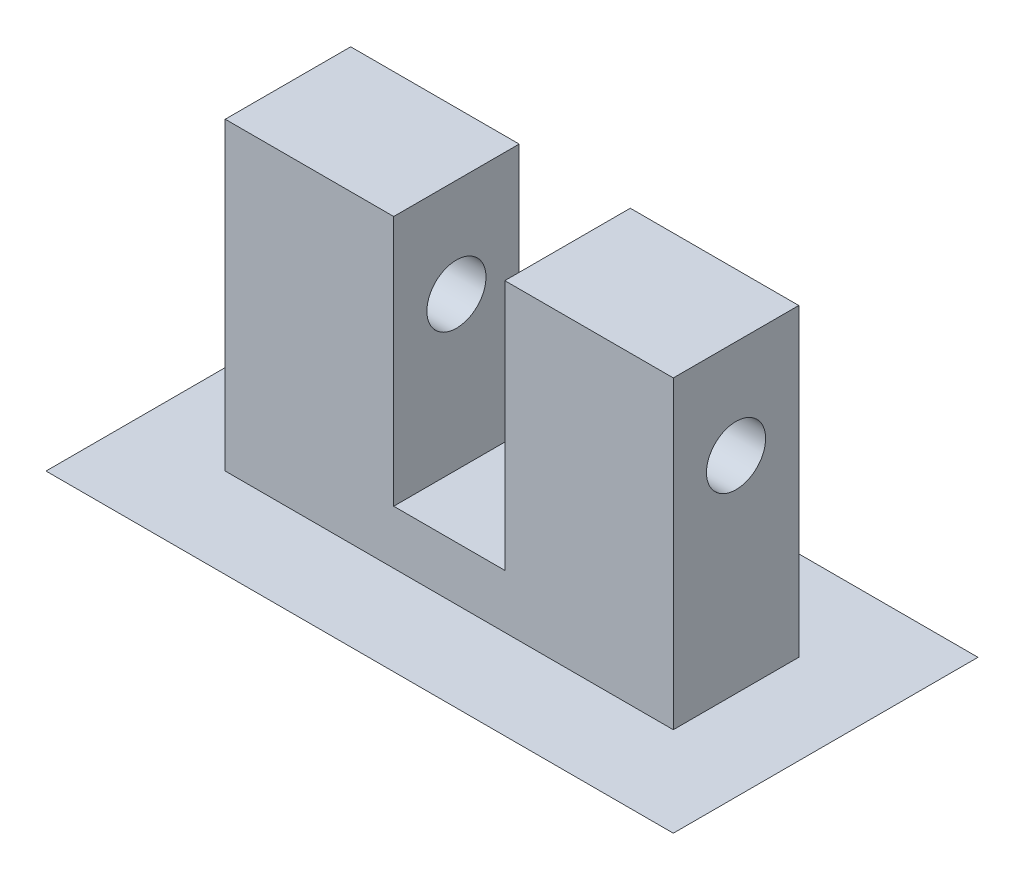
from build123d import *

# Parameters (mm, degrees)
SKETCH1_W           = 25
SKETCH1_H           = 7
BOSS_EXTRUDE1_DEPTH = 20
SKETCH2_W           = 35
SKETCH2_H           = 17
BOSS_EXTRUDE2_DEPTH = 3
CHAMFER1_SIZE       = 5.196152423
CHAMFER1_SIZE_2     = 3
SKETCH3_W           = 6.2
SKETCH3_H           = 14
CUT_EXTRUDE1_DEPTH  = 7
CUT_EXTRUDE2_REACH  = 40
SKETCH4_R           = 1.65


with BuildPart() as part:
    # Sketch1 → Boss-Extrude1 (new body)
    with BuildSketch(Plane(origin=(0, 0, 0), x_dir=(1, 0, 0), z_dir=(0, 1, 0))):
        with Locations((12.5, 3.5)):
            Rectangle(SKETCH1_W, SKETCH1_H)
    extrude(amount=BOSS_EXTRUDE1_DEPTH)

    # Sketch2 → Boss-Extrude2 (add)
    with BuildSketch(Plane.XZ):
        with Locations((12.5, -3.5)):
            Rectangle(SKETCH2_W, SKETCH2_H)
    extrude(amount=-BOSS_EXTRUDE2_DEPTH)

    # Chamfer1
    # the kernel refuses this chamfer: 5.196152423, 3 mm, written as the material it takes off along each edge
    with BuildSketch(Plane(origin=(30, 0, 18.442891912), x_dir=(-0.9998132206222079, -0.01932676561270063, 0), z_dir=(0, 0, -1)), Plane(origin=(-5, 0, -25.442891912), x_dir=(0.9998132206222079, -0.019326765612700626, 0), z_dir=(0, 0, 1))) as chamfer1_piece_1:
        Polygon((CHAMFER1_SIZE * 0.999813220566, CHAMFER1_SIZE * 0.0193267656116), (-CHAMFER1_SIZE_2 * 0.0193267656127, CHAMFER1_SIZE_2 * 0.999813220622), (0, 0), align=None)
    extrude(amount=43.885783824, mode=Mode.SUBTRACT)
    with BuildSketch(Plane(origin=(-18.442891912, 0, 5), x_dir=(0, -0.019326765612700626, -0.9998132206222079), z_dir=(1, 0, 0)), Plane(origin=(43.442891912, 0, -12), x_dir=(0, -0.019326765612700622, 0.9998132206222079), z_dir=(-1, 0, 0))) as chamfer1_piece_2:
        Polygon((CHAMFER1_SIZE * 0.999813220566, CHAMFER1_SIZE * 0.0193267656116), (-CHAMFER1_SIZE_2 * 0.0193267656127, CHAMFER1_SIZE_2 * 0.999813220622), (0, 0), align=None)
    extrude(amount=61.885783824, mode=Mode.SUBTRACT)

    # Sketch3 → Cut-Extrude1 (cut)
    with BuildSketch(Plane(origin=(0, 0, -7), x_dir=(-1, 0, 0), z_dir=(0, 0, -1))):
        with Locations((-12.5, 13)):
            Rectangle(SKETCH3_W, SKETCH3_H)
    extrude(amount=-CUT_EXTRUDE1_DEPTH, mode=Mode.SUBTRACT)

    # Cut-Extrude2: up to this face of the body (flat: up to its plane)
    cut_extrude2_end = Plane(part.part.faces().sort_by_distance((25, 11.5, -3.5))[0])
    # Sketch4 → Cut-Extrude2 (cut, up to the picked face)
    with BuildSketch(Plane.ZY, mode=Mode.PRIVATE) as cut_extrude2_sk1:
        with Locations((-3.5, 14.5)):
            Circle(SKETCH4_R)
    cut_extrude2_tool1 = split(extrude(cut_extrude2_sk1.sketch, amount=-CUT_EXTRUDE2_REACH, mode=Mode.PRIVATE), bisect_by=cut_extrude2_end, keep=Keep.BOTH, mode=Mode.PRIVATE)
    add(cut_extrude2_tool1.solids().sort_by(Axis((0, 14.5, -3.5), (1, 0, 0)))[0], mode=Mode.SUBTRACT)


solid = part.part
